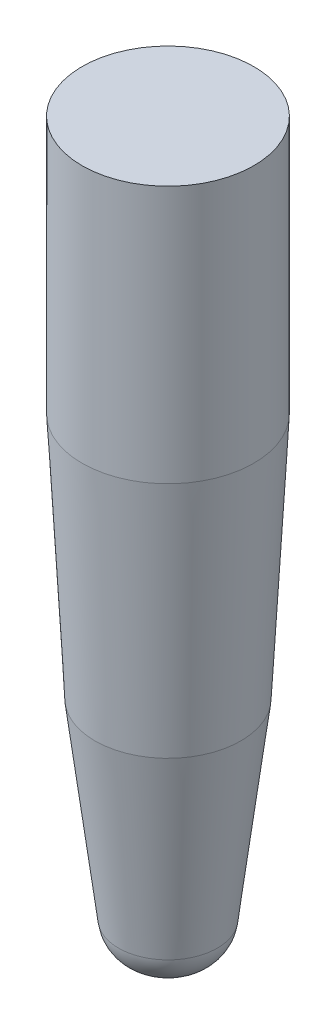
from build123d import *

# Parameters (mm, degrees)
SKETCH_606_R    = 8
EXTRUDE_1_DEPTH = 24


# Read off the part's stored shape, not the designer's step: 凸台-拉伸2
with BuildPart() as part:
    # Sketch 606 → 凸台-拉伸1 (new body)
    with BuildSketch(Plane(origin=(0, 0, 0), x_dir=(1, 0, 0), z_dir=(0, 1, 0))):
        with Locations(Location((0, 0, 0), (0, 0, 270))):
            Circle(SKETCH_606_R)
    extrude(amount=EXTRUDE_1_DEPTH)

    # 凸台-拉伸2 outline → 凸台-拉伸2 (revolve)
    with BuildSketch(Plane.XY):
        Polygon((0, -23), (6.794621076, -23), (8, 0), (0, 0), align=None)
    revolve(axis=Axis((0, 0, 0), (0, 1, 0)))

    # 草图7 → 旋转4 (revolve)
    with BuildSketch(Plane.XY, mode=Mode.PRIVATE) as revolve_4_sk:
        with BuildLine():
            Line((0, -23), (6.794621076, -23))
            Line((6.794621076, -23), (4.608094813, -40.807827362))
            ThreePointArc((4.608094813, -40.807827362), (3.408750419, -43.087406102), (1, -44))
            Line((1, -44), (0, -44))
            Line((0, -44), (0, -23))
        make_face()
    revolve(revolve_4_sk.sketch.rotate(Axis((0, -23, 0), (0, -1, 0)), 180), axis=Axis((0, -23, 0), (0, -1, 0)))


solid = part.part
